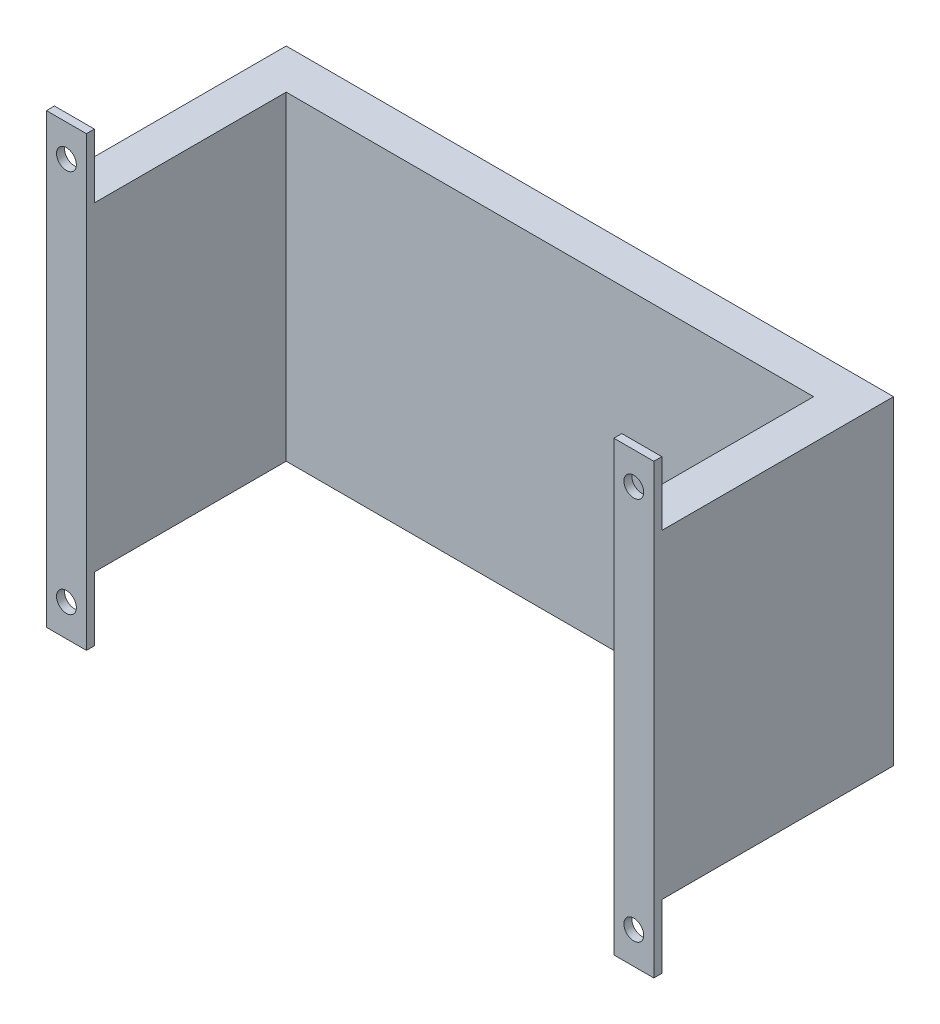
from build123d import *

# Parameters (mm, degrees)
SKETCH1_W           = 241.3
SKETCH1_H           = 127
BOSS_EXTRUDE1_DEPTH = 95.25
SKETCH5_W           = 209.55
SKETCH5_H           = 127
CUT_EXTRUDE1_DEPTH  = 79.375
SKETCH6_W           = 15.875
SKETCH6_H           = 25.4
BOSS_EXTRUDE2_DEPTH = 3.175
SKETCH7_R           = 3.937
CUT_EXTRUDE2_DEPTH  = 176.890415103


with BuildPart() as part:
    # Sketch1 → Boss-Extrude1 (new body)
    with BuildSketch(Plane.XY):
        Rectangle(SKETCH1_W, SKETCH1_H)
    extrude(amount=BOSS_EXTRUDE1_DEPTH)

    # Sketch5 → Cut-Extrude1 (cut)
    with BuildSketch(Plane.XY.offset(95.25)):
        Rectangle(SKETCH5_W, SKETCH5_H)
    extrude(amount=-CUT_EXTRUDE1_DEPTH, mode=Mode.SUBTRACT)

    # Sketch6 → Boss-Extrude2 (add)
    with BuildSketch(Plane.XY.offset(95.25)):
        with Locations((112.7125, 76.2)):
            Rectangle(SKETCH6_W, SKETCH6_H)
        with Locations((-112.7125, 76.2)):
            Rectangle(SKETCH6_W, SKETCH6_H)
        with Locations((112.7125, -76.2)):
            Rectangle(SKETCH6_W, SKETCH6_H)
        with Locations((-112.7125, -76.2)):
            Rectangle(SKETCH6_W, SKETCH6_H)
    extrude(amount=-BOSS_EXTRUDE2_DEPTH)

    # Sketch7 → Cut-Extrude2 (cut, through all)
    with BuildSketch(Plane(origin=(0, 0, 92.075), x_dir=(-1, 0, 0), z_dir=(0, 0, -1))):
        with Locations((112.7125, 76.2)):
            Circle(SKETCH7_R)
        with Locations((-112.7125, 76.2)):
            Circle(SKETCH7_R)
        with Locations((112.7125, -76.2)):
            Circle(SKETCH7_R)
        with Locations((-112.7125, -76.2)):
            Circle(SKETCH7_R)
    extrude(amount=-CUT_EXTRUDE2_DEPTH, mode=Mode.SUBTRACT)


solid = part.part
